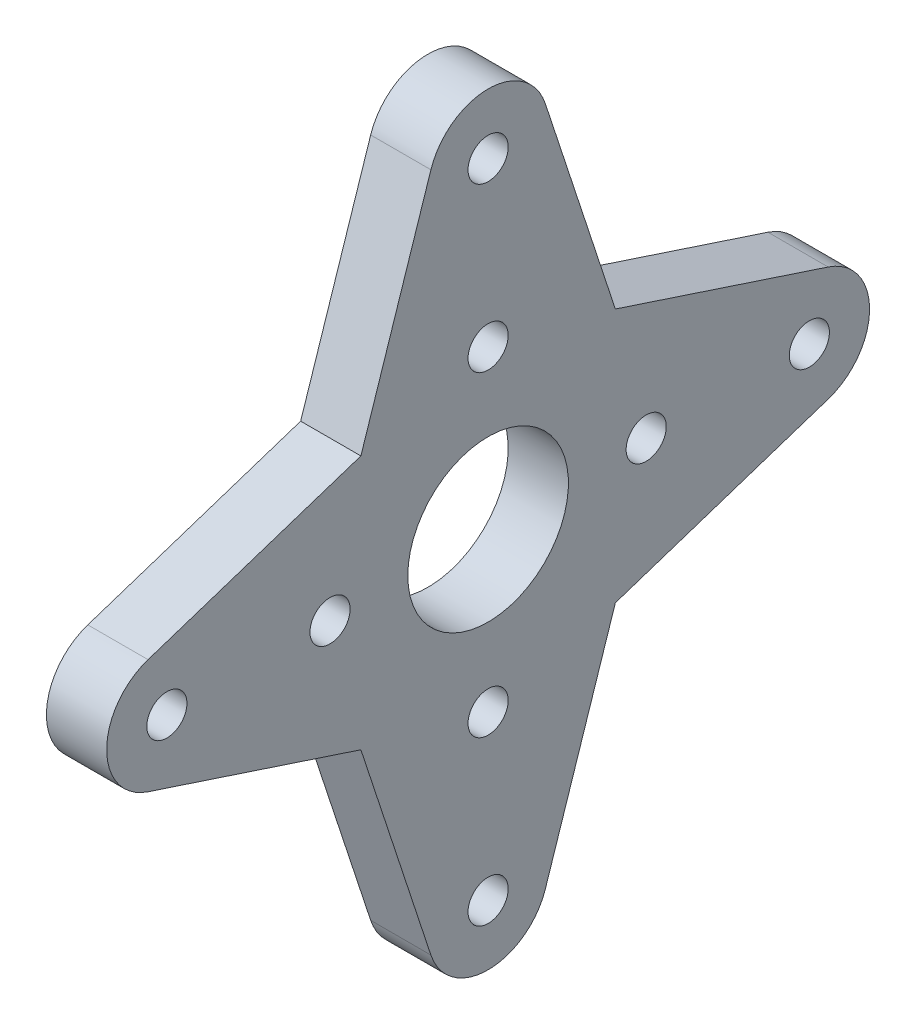
from build123d import *

# Parameters (mm, degrees)
SKETCH1_R           = 1.5875
SKETCH1_R_2         = 6.35
BOSS_EXTRUDE1_DEPTH = 4.7625


with BuildPart() as part:
    # Sketch1 → Boss-Extrude1 (new body)
    with BuildSketch(Plane(origin=(0, 0, 0), x_dir=(0, 0, -1), z_dir=(1, 0, 0))):
        with BuildLine():
            Line((10.060061262, 10.060061262), (4.52398333, 26.88828125))
            ThreePointArc((4.52398333, 26.88828125), (0, 30.1625), (-4.52398333, 26.88828125))
            Line((-4.52398333, 26.88828125), (-10.060061262, 10.060061262))
            Line((-10.060061262, 10.060061262), (-26.88828125, 4.52398333))
            ThreePointArc((-26.88828125, 4.52398333), (-30.1625, 0), (-26.88828125, -4.52398333))
            Line((-26.88828125, -4.52398333), (-10.060061262, -10.060061262))
            Line((-10.060061262, -10.060061262), (-4.52398333, -26.88828125))
            ThreePointArc((-4.52398333, -26.88828125), (0, -30.1625), (4.52398333, -26.88828125))
            Line((4.52398333, -26.88828125), (10.060061262, -10.060061262))
            Line((10.060061262, -10.060061262), (26.88828125, -4.52398333))
            ThreePointArc((26.88828125, -4.52398333), (30.1625, 0), (26.88828125, 4.52398333))
            Line((26.88828125, 4.52398333), (10.060061262, 10.060061262))
        make_face()
        with Locations((0, -25.4)):
            Circle(SKETCH1_R, mode=Mode.SUBTRACT)
        with Locations((0, -12.5)):
            Circle(SKETCH1_R, mode=Mode.SUBTRACT)
        with Locations((12.5, 0)):
            Circle(SKETCH1_R, mode=Mode.SUBTRACT)
        with Locations((25.4, 0)):
            Circle(SKETCH1_R, mode=Mode.SUBTRACT)
        with Locations((-25.4, 0)):
            Circle(SKETCH1_R, mode=Mode.SUBTRACT)
        with Locations((-12.5, 0)):
            Circle(SKETCH1_R, mode=Mode.SUBTRACT)
        Circle(SKETCH1_R_2, mode=Mode.SUBTRACT)
        with Locations((0, 12.5)):
            Circle(SKETCH1_R, mode=Mode.SUBTRACT)
        with Locations((0, 25.4)):
            Circle(SKETCH1_R, mode=Mode.SUBTRACT)
    extrude(amount=BOSS_EXTRUDE1_DEPTH)


solid = part.part
